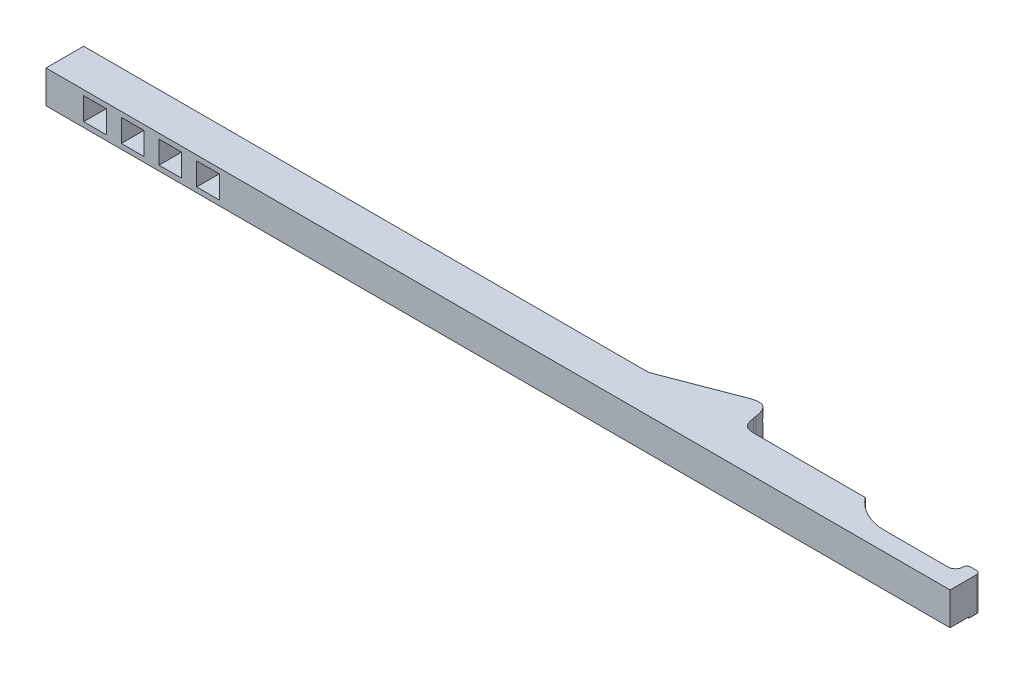
from build123d import *

# Parameters (mm, degrees)
ESBO_O1_W                = 5
ESBO_O1_H                = 4.35
RESSALTO_EXTRUS_O1_DEPTH = 120
RESSALTO_EXTRUS_O2_DEPTH = 4.35
CUT_EXTRUDE2_DEPTH       = 10
CUT_EXTRUDE3_DEPTH       = 10
SKETCH17_W               = 1.7804771699968711
SKETCH17_H               = 4.499999999999998
BOSS_EXTRUDE2_DEPTH      = 1.5
FILLET8_R                = 1
FILLET9_R                = 0.5


with BuildPart() as part:
    # Esboço1 → Ressalto-extrusão1 (new body)
    with BuildSketch(Plane(origin=(0, 0, 0), x_dir=(0, 0, -1), z_dir=(1, 0, 0))):
        with Locations((-2.5000000000000098, 0)):
            Rectangle(ESBO_O1_W, ESBO_O1_H)
    extrude(amount=RESSALTO_EXTRUS_O1_DEPTH)

    # Esboço2 → Ressalto-extrusão2 (add)
    with BuildSketch(Plane(origin=(0, 2.175, 0), x_dir=(1, 0, 0), z_dir=(0, 1, 0))):
        Polygon((75, -9.63e-15), (87.5, -9.63e-15), (86.75, 4.49999999999999), align=None)
    extrude(amount=-RESSALTO_EXTRUS_O2_DEPTH)

    # Sketch12 → Cut-Extrude2 (cut)
    with BuildSketch(Plane(origin=(0, 2.175, 0), x_dir=(1, 0, 0), z_dir=(0, 1, 1.7e-16))):
        with BuildLine():
            Line((120, -2.5000000000000098), (108.78052366211932, -2.500000000000011))
            ThreePointArc((108.78052366211932, -2.500000000000011), (105.97177980074898, -1.8405473191538975), (103.75, -2.99e-15))
            Line((103.75, -2.99e-15), (120, -9.22e-15))
            Line((120, -9.22e-15), (120, -2.5000000000000098))
        make_face()
    extrude(amount=-CUT_EXTRUDE2_DEPTH, mode=Mode.SUBTRACT)

    # Fillet5
    # a fillet whose section is not a circle: 2 mm, written as the material it takes off along each edge
    with BuildSketch(Plane(origin=(86.75, 8.293980956389628, -4.49999999999999), x_dir=(-0.9338567516961642, 0, 0.35764726660704255), z_dir=(0, -1, 0))) as fillet5_piece_1:
        with BuildLine():
            Bezier((2.4475923825558348, 0), (6.4e-16, -1.66e-15), (0.48769743446495956, -2.3985119727784827), weights=[1, 1.2654991217782485, 1])
            Line((0.48769743446495956, -2.3985119727784827), (0, 0))
            Line((0, 0), (2.4475923825558348, 0))
        make_face()
    extrude(amount=16.587961912779257, mode=Mode.SUBTRACT)

    # Fillet6
    # a fillet whose section is not a circle: 2 mm, written as the material it adds along each edge
    with BuildSketch(Plane(origin=(75, 2.175, 9.63e-15), x_dir=(-1, 0, -2e-17), z_dir=(0, -1, 0))) as fillet6_piece_1:
        with BuildLine():
            Bezier((0.36987979207182775, 0), (0, 1e-17), (-0.3454147411422639, 0.13228649660767453), weights=[1, 1.966650325653325, 1])
            Line((-0.3454147411422639, 0.13228649660767453), (0, 0))
            Line((0, 0), (0.36987979207182775, 0))
        make_face()
    extrude(amount=4.35)

    # Fillet7
    # a fillet whose section is not a circle: 2 mm, written as the material it adds along each edge
    with BuildSketch(Plane(origin=(87.5, 2.175, 9.63e-15), x_dir=(1, 0, -1e-17), z_dir=(0, -1, 0))) as fillet7_piece_1:
        with BuildLine():
            Bezier((1.69425417676608, 0), (0, -1e-17), (-0.2785336708982129, -1.671202025389285), weights=[1, 1.5260399649454515, 1])
            Line((-0.2785336708982129, -1.671202025389285), (0, 0))
            Line((0, 0), (1.69425417676608, 0))
        make_face()
    extrude(amount=4.35)

    # Sketch16 → Cut-Extrude3 (cut)
    with BuildSketch(Plane.XY):
        Polygon((23.000000000000007, -1.4999999999999984), (20.000000000000007, -1.499999999999998), (20.000000000000004, 1.500000000000001), (23.000000000000007, 1.5000000000000013), align=None)
        Polygon((18.000000000000004, -1.4999999999999978), (15.000000000000002, -1.4999999999999984), (14.999999999999998, 1.5000000000000007), (18.000000000000004, 1.5000000000000013), align=None)
        Polygon((13.000000000000004, -1.4999999999999958), (10.000000000000002, -1.4999999999999964), (10.000000000000005, 1.5000000000000029), (13.000000000000007, 1.5000000000000036), align=None)
        Polygon((8, -1.4999999999999956), (5.000000000000001, -1.4999999999999953), (4.999999999999997, 1.500000000000004), (7.9999999999999964, 1.5000000000000038), align=None)
    extrude(amount=CUT_EXTRUDE3_DEPTH, mode=Mode.SUBTRACT)

    # Sketch17 → Boss-Extrude2 (add)
    with BuildSketch(Plane(origin=(2.9e-16, -4.3e-16, 2.500000000000023), x_dir=(-1, 0, 0), z_dir=(0, 1.7e-16, -1))):
        with Locations((-119.10976141500157, -0.07499999999999951)):
            Rectangle(SKETCH17_W, SKETCH17_H)
    extrude(amount=BOSS_EXTRUDE2_DEPTH)

    # Fillet8
    fillet8_edges = [part.edges().sort_by_distance(p)[0] for p in [
        (118.21952283000314, -4.3e-16, 2.500000000000023),
    ]]
    fillet(fillet8_edges, radius=FILLET8_R)

    # Fillet9
    fillet9_edges = [part.edges().sort_by_distance(p)[0] for p in [
        (120, -0.07499999999999947, 1.000000000000023),
        (118.21952283000314, -0.07499999999999991, 1.000000000000023),
    ]]
    fillet(fillet9_edges, radius=FILLET9_R)


solid = part.part
